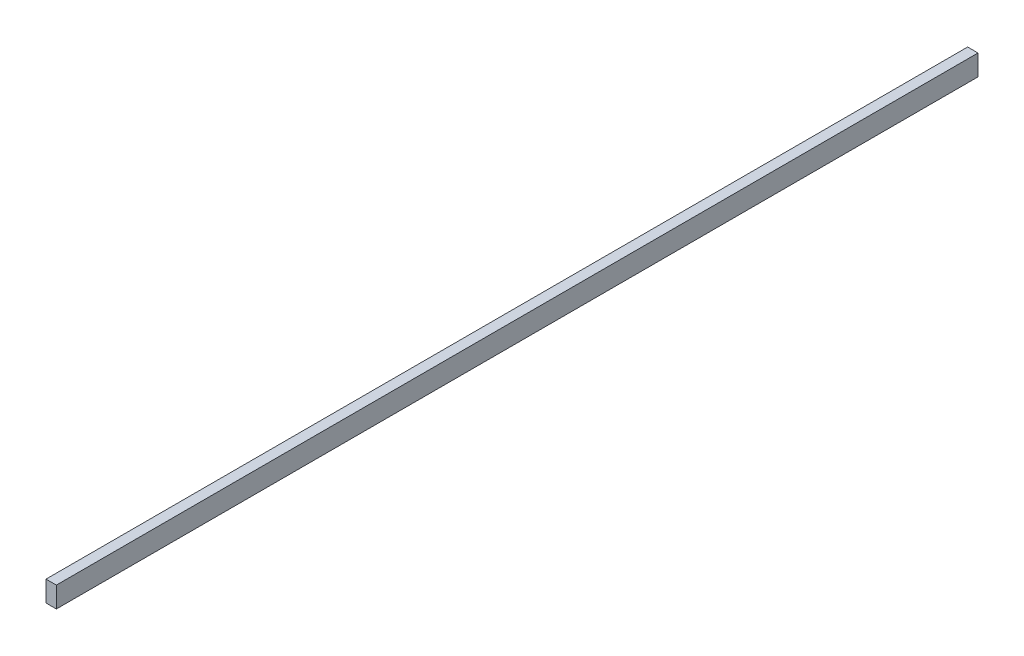
from build123d import *

# Parameters (mm, degrees)
SKIZZE1_W                       = 5
SKIZZE1_H                       = 10
AUFSATZ_LINEAR_AUSTRAGEN1_DEPTH = 445


with BuildPart() as part:
    # Skizze1 → Aufsatz-Linear austragen1 (new body)
    with BuildSketch(Plane.XY):
        with Locations((2.5, 5)):
            Rectangle(SKIZZE1_W, SKIZZE1_H)
    extrude(amount=AUFSATZ_LINEAR_AUSTRAGEN1_DEPTH)


solid = part.part
